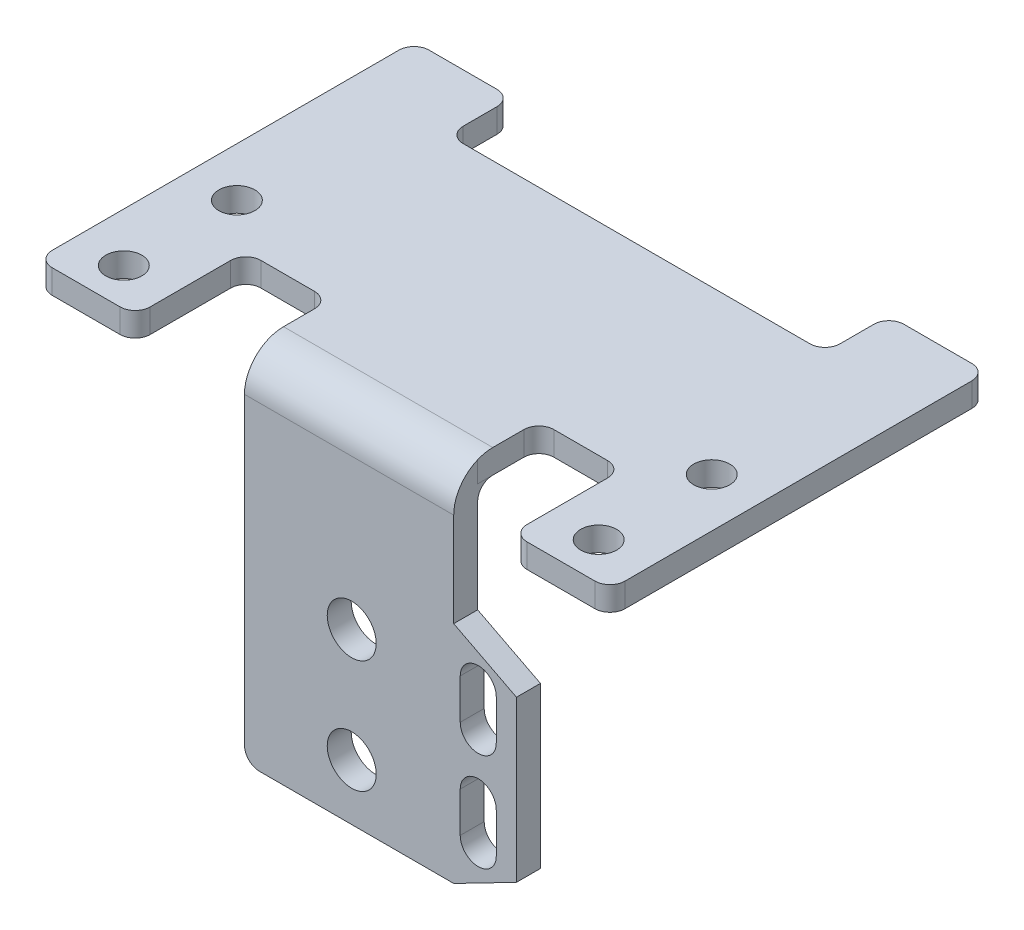
from build123d import *

# Parameters (mm, degrees)
BOSS_EXTRUDE2_DEPTH = 3.18
SKETCH8_R           = 3.25
BOSS_EXTRUDE3_DEPTH = 3.18
FILLET4_R           = 5.18
FILLET5_R           = 2
SKETCH9_R           = 2.39
CUT_EXTRUDE1_DEPTH  = 3.18
FILLET6_R           = 2
FILLET7_R           = 2
FILLET8_R           = 2


with BuildPart() as part:
    # Sketch1 → Boss-Extrude2 (new body)
    with BuildSketch(Plane(origin=(0, 0, 0), x_dir=(1, 0, 0), z_dir=(0, 1, 0))):
        Polygon((0, 0), (0, 50), (13, 50), (13, 41.521912351), (63, 41.521912351), (63, 50), (76, 50), (76, 0), (63, 0), (63, 14.685258964), (51.88, 14.685258964), (51.88, 6.566903426), (24.12, 6.566903426), (24.12, 14.685258964), (13, 14.685258964), (13, 0), align=None)
    extrude(amount=-BOSS_EXTRUDE2_DEPTH)

    # Sketch8 → Boss-Extrude3 (add)
    with BuildSketch(Plane.XY.offset(-6.566903426)):
        with BuildLine():
            Line((24.12, -45.5), (24.12, -20.153398116))
            Line((24.12, -20.153398116), (24.12, 0))
            Line((24.12, 0), (51.879574545, 0))
            Line((51.879574545, 0), (51.879574545, -17.65))
            Line((51.879574545, -17.65), (60.204359999, -21.94))
            Line((60.204359999, -21.94), (60.204359999, -43.21))
            Line((60.204359999, -43.21), (51.879574545, -47.5))
            Line((51.879574545, -47.5), (26.12, -47.5))
            ThreePointArc((26.12, -47.5), (24.705786438, -46.914213562), (24.12, -45.5))
        make_face()
        with Locations((38.348750497, -25.08)):
            Circle(SKETCH8_R, mode=Mode.SUBTRACT)
        with Locations((38.348750497, -40.08)):
            Circle(SKETCH8_R, mode=Mode.SUBTRACT)
        with BuildLine():
            Line((57.524359999, -23.223501404), (57.524359999, -28.546918648))
            ThreePointArc((57.524359999, -28.546918648), (55.134359999, -30.936918648), (52.744359999, -28.546918648))
            Line((52.744359999, -28.546918648), (52.744359999, -23.223501404))
            ThreePointArc((52.744359999, -23.223501404), (55.134359999, -20.833501404), (57.524359999, -23.223501404))
        make_face(mode=Mode.SUBTRACT)
        with BuildLine():
            Line((57.524359999, -36.223501404), (57.524359999, -41.546918648))
            ThreePointArc((57.524359999, -41.546918648), (55.134359999, -43.936918648), (52.744359999, -41.546918648))
            Line((52.744359999, -41.546918648), (52.744359999, -36.223501404))
            ThreePointArc((52.744359999, -36.223501404), (55.134359999, -33.833501404), (57.524359999, -36.223501404))
        make_face(mode=Mode.SUBTRACT)
    extrude(amount=BOSS_EXTRUDE3_DEPTH)

    # Fillet4
    fillet4_edges = [part.edges().sort_by_distance(p)[0] for p in [
        (37.999787272, 0, -3.386903426),
    ]]
    fillet(fillet4_edges, radius=FILLET4_R)

    # Fillet5
    fillet5_edges = [part.edges().sort_by_distance(p)[0] for p in [
        (37.999787272, -3.18, -6.566903426),
    ]]
    fillet(fillet5_edges, radius=FILLET5_R)

    # Sketch9 → Cut-Extrude1 (cut)
    with BuildSketch(Plane(origin=(0, 0, 0), x_dir=(1, 0, 0), z_dir=(0, 1, 0))):
        with Locations((6.5, 5)):
            Circle(SKETCH9_R)
        with Locations((6.5, 20)):
            Circle(SKETCH9_R)
        with Locations((69.5, 20)):
            Circle(SKETCH9_R)
        with Locations((69.5, 5)):
            Circle(SKETCH9_R)
    extrude(amount=-CUT_EXTRUDE1_DEPTH, mode=Mode.SUBTRACT)

    # Fillet6
    fillet6_edges = [part.edges().sort_by_distance(p)[0] for p in [
        (0, -1.59, 0),
    ]]
    fillet(fillet6_edges, radius=FILLET6_R)

    # Fillet7
    fillet7_edges = [part.edges().sort_by_distance(p)[0] for p in [
        (13, -1.59, 0),
    ]]
    fillet(fillet7_edges, radius=FILLET7_R)

    # Fillet8
    fillet8_edges = [part.edges().sort_by_distance(p)[0] for p in [
        (51.88, -1.59, -14.685258964),
        (13, -1.59, -14.685258964),
        (13, -1.59, -41.521912351),
        (63, -1.59, -41.521912351),
        (76, -1.59, -50),
        (63, -1.59, -50),
        (0, -1.59, -50),
        (13, -1.59, -50),
        (63, -1.59, -14.685258964),
        (24.12, -1.59, -14.685258964),
        (76, -1.59, 0),
        (63, -1.59, 0),
    ]]
    fillet(fillet8_edges, radius=FILLET8_R)


solid = part.part
